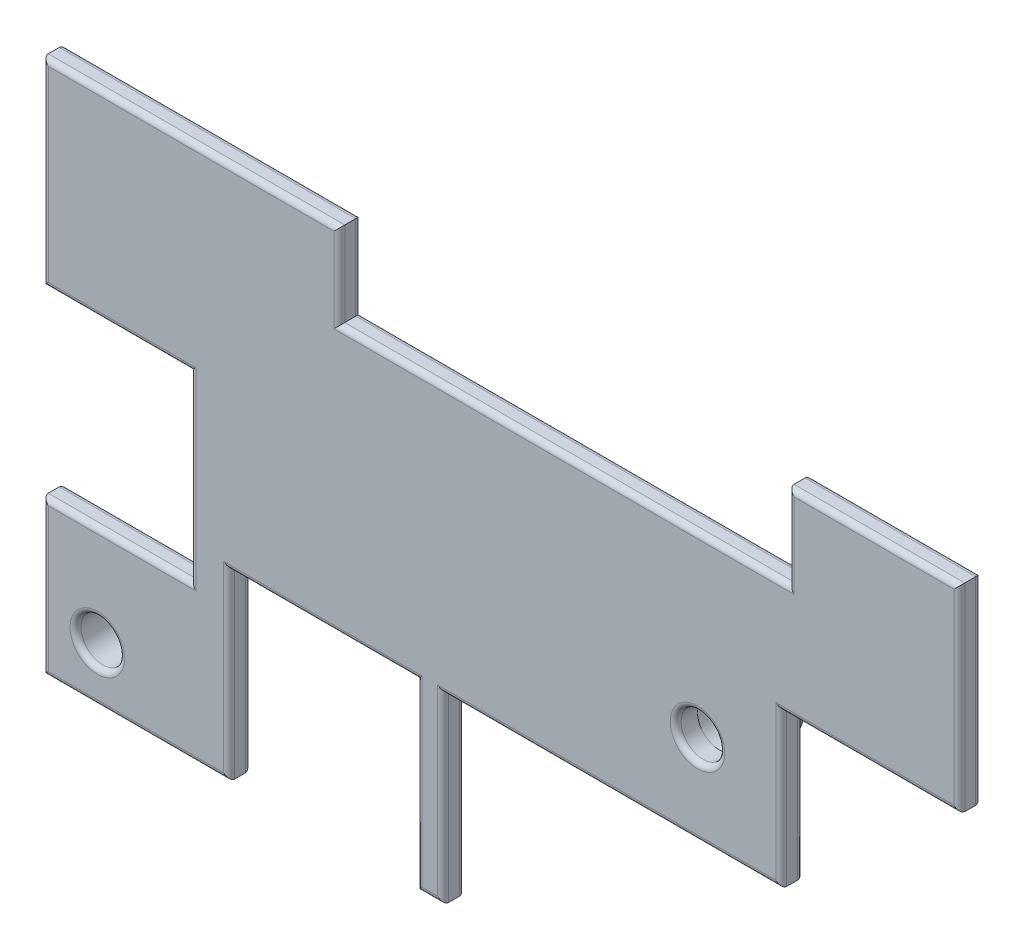
from build123d import *

# Parameters (mm, degrees)
SKETCH1_R           = 2
BOSS_EXTRUDE1_DEPTH = 2
BOSS_EXTRUDE2_START = 5
SKETCH3_R           = 3
SKETCH3_R_2         = 2
SKETCH3_R_3         = 3.033258003
SKETCH3_R_4         = 2.117068996
BOSS_EXTRUDE2_DEPTH = 5
FILLET10_R          = 0.5


with BuildPart() as part:
    # Sketch1 → Boss-Extrude1 (new body)
    with BuildSketch(Plane(origin=(0, 0, 0), x_dir=(0, 1, 0), z_dir=(0, 0, 1))):
        Polygon((-6.260305123, 38.670258774), (-6.260305123, 25.150975213), (10.467957273, 25.150975213), (10.467957273, 38.670258774), (28.613809074, 38.670258774), (28.613809074, 11.495236372), (20.870669154, 11.495236372), (20.870669154, -29.678429359), (28.613809074, -29.678429359), (28.613809074, -45.329741226), (10.467957273, -45.329741226), (10.467957273, -29.006824236), (-3.632814453, -29.006824236), (-3.632814453, -15.000766179), (-3.632814453, 1.989705429), (-20.411264345, 1.989705429), (-20.411264345, 4.399811924), (-3.632814453, 4.399811924), (-3.632814453, 21.590258774), (-20.411264345, 21.590258774), (-20.411264345, 38.670258774), align=None)
        with Locations((-15.386190926, 33.670258774)):
            Circle(SKETCH1_R, mode=Mode.SUBTRACT)
        with Locations((4.613809074, -21.329741226)):
            Circle(SKETCH1_R, mode=Mode.SUBTRACT)
    extrude(amount=BOSS_EXTRUDE1_DEPTH)

    # Sketch3 → Boss-Extrude2 (add)
    # profile 1 of 2: a face of its own
    with BuildSketch(Plane(origin=(0, 0, 0), x_dir=(1, 0, 0), z_dir=(0, 0, -1)).offset(BOSS_EXTRUDE2_START)):
        with Locations((-33.670258774, 15.386190926)):
            Circle(SKETCH3_R)
        with Locations((-33.670258774, 15.386190926)):
            Circle(SKETCH3_R_2, mode=Mode.SUBTRACT)
    # profile 2 of 2: a face of its own
    with BuildSketch(Plane(origin=(0, 0, 0), x_dir=(1, 0, 0), z_dir=(0, 0, -1)).offset(BOSS_EXTRUDE2_START)):
        with Locations((21.342953219, -4.637560479)):
            Circle(SKETCH3_R_3)
        with Locations((21.342953219, -4.637560479)):
            Circle(SKETCH3_R_4, mode=Mode.SUBTRACT)
    extrude(amount=-BOSS_EXTRUDE2_DEPTH)

    # Fillet10
    fillet10_edges = [part.edges().sort_by_distance(p)[0] for p in [
        (18.309695215, 4.637560479, -5),
        (-36.670258774, -15.386190926, -5),
        (21.329741226, 2.613809074, 2),
        (-33.670258774, -17.386190926, 2),
        (-31.910616994, -6.260305123, 2),
        (-25.150975213, 2.103826075, 2),
        (-31.910616994, 10.467957273, 2),
        (-38.670258774, 19.540883174, 2),
        (-25.082747573, 28.613809074, 2),
        (-11.495236372, 24.742239114, 2),
        (9.091596493, 20.870669154, 2),
        (29.678429359, 24.742239114, 2),
        (37.504085292, 28.613809074, 2),
        (45.329741226, 19.540883174, 2),
        (37.168282731, 10.467957273, 2),
        (29.006824236, 3.41757141, 2),
        (13.508559404, -3.632814453, 2),
        (-1.989705429, -12.022039399, 2),
        (-3.194758676, -20.411264345, 2),
        (-4.399811924, -12.022039399, 2),
        (-12.995035349, -3.632814453, 2),
        (-21.590258774, -12.022039399, 2),
        (-30.130258774, -20.411264345, 2),
        (-38.670258774, -13.335784734, 2),
        (-30.130258774, -20.411264345, 0),
        (-21.590258774, -12.022039399, 0),
        (-12.995035349, -3.632814453, 0),
        (-4.399811924, -12.022039399, 0),
        (-3.194758676, -20.411264345, 0),
        (-1.989705429, -12.022039399, 0),
        (13.508559404, -3.632814453, 0),
        (29.006824236, 3.41757141, 0),
        (37.168282731, 10.467957273, 0),
        (45.329741226, 19.540883174, 0),
        (37.504085292, 28.613809074, 0),
        (29.678429359, 24.742239114, 0),
        (9.091596493, 20.870669154, 0),
        (-11.495236372, 24.742239114, 0),
        (-25.082747573, 28.613809074, 0),
        (-38.670258774, 19.540883174, 0),
        (-31.910616994, 10.467957273, 0),
        (-25.150975213, 2.103826075, 0),
        (-31.910616994, -6.260305123, 0),
        (-38.670258774, -13.335784734, 0),
        (18.309695215, 4.637560479, 0),
        (-36.670258774, -15.386190926, 0),
    ]]
    fillet(fillet10_edges, radius=FILLET10_R)


solid = part.part
